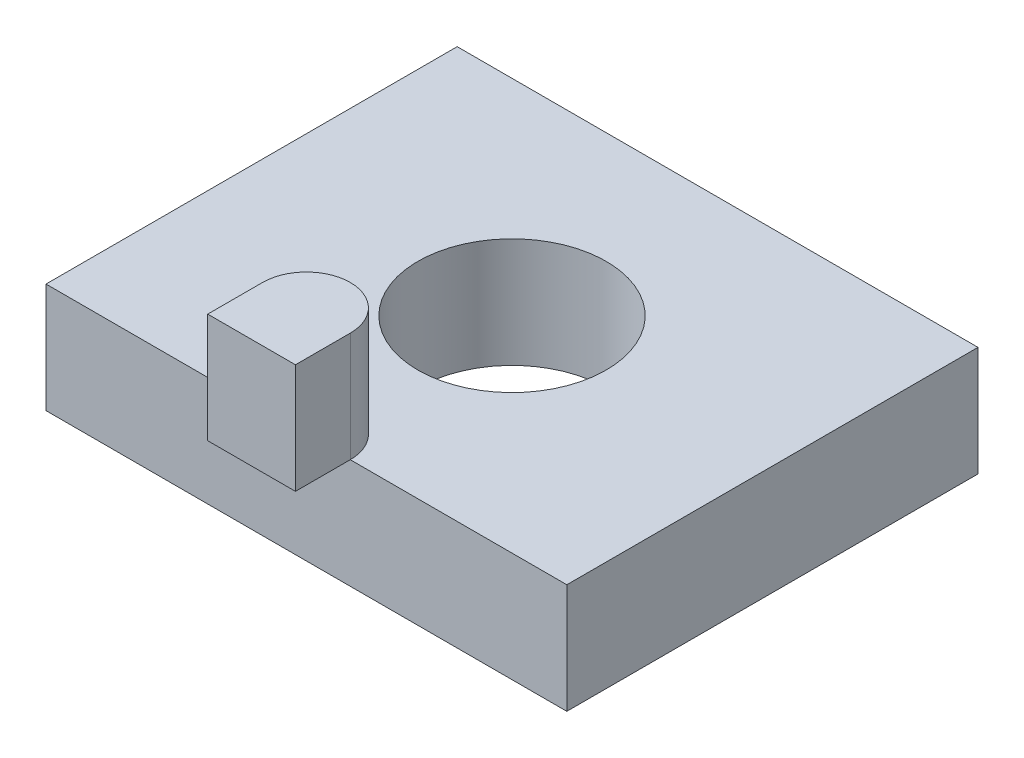
from build123d import *

# Parameters (mm, degrees)
SKETCH1_W           = 95
SKETCH1_H           = 75
BOSS_EXTRUDE1_DEPTH = 10
SKETCH2_W           = 8
SKETCH2_H           = 20
REVOLVE1_ANGLE      = 180
SKETCH3_W           = 16
SKETCH3_H           = 20
BOSS_EXTRUDE2_DEPTH = 10
SKETCH4_R           = 17.178882312
CUT_EXTRUDE1_DEPTH  = 71.089228844


with BuildPart() as part:
    # Sketch1 → Boss-Extrude1 (new, symmetric)
    with BuildSketch(Plane(origin=(0, 0, 0), x_dir=(1, 0, 0), z_dir=(0, 1, 0))):
        Rectangle(SKETCH1_W, SKETCH1_H)
    extrude(amount=BOSS_EXTRUDE1_DEPTH, both=True)

    # Sketch2 → Revolve1 (revolve)
    with BuildSketch(Plane.XY.offset(37.5)):
        with Locations((-4, 20)):
            Rectangle(SKETCH2_W, SKETCH2_H)
    revolve(axis=Axis((0, 10, 37.5), (0, -1, 0)), revolution_arc=REVOLVE1_ANGLE)

    # Sketch3 → Boss-Extrude2 (add)
    with BuildSketch(Plane.XY.offset(37.5)):
        with Locations((0, 20)):
            Rectangle(SKETCH3_W, SKETCH3_H)
    extrude(amount=BOSS_EXTRUDE2_DEPTH)

    # Sketch4 → Cut-Extrude1 (cut, through all)
    with BuildSketch(Plane(origin=(0, 10, 0), x_dir=(1, 0, 0), z_dir=(0, 1, 0))):
        Circle(SKETCH4_R)
    extrude(amount=-CUT_EXTRUDE1_DEPTH, mode=Mode.SUBTRACT)


solid = part.part
